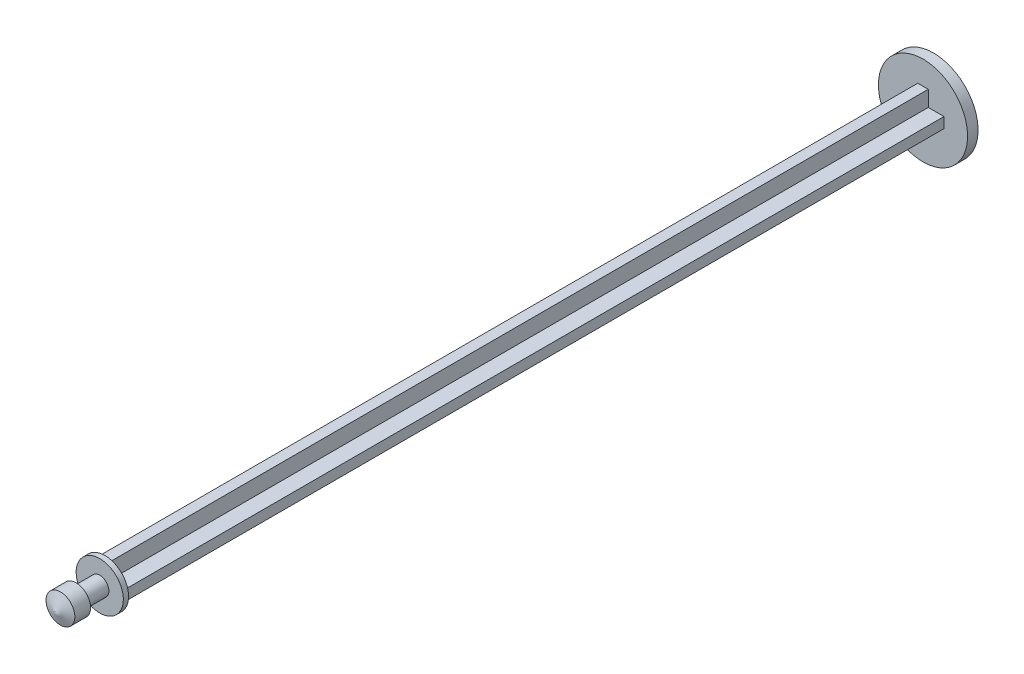
from build123d import *

# Parameters (mm, degrees)
AUFSATZ_LINEAR_AUSTRAGEN1_DEPTH = 78
SKIZZE3_R                       = 4.25
AUFSATZ_LINEAR_AUSTRAGEN3_DEPTH = 1
FASE1_SIZE2                     = 1.375
FASE1_SIZE                      = 0.500459072


with BuildPart() as part:
    # Skizze1 → Aufsatz-Linear austragen1 (new body)
    with BuildSketch(Plane.XY):
        Polygon((0.5, 0.5), (2, 0.5), (2, -0.5), (0.5, -0.5), (0.5, -2), (-0.5, -2), (-0.5, -0.5), (-2, -0.5), (-2, 0.5), (-0.5, 0.5), (-0.5, 2), (0.5, 2), align=None)
    extrude(amount=AUFSATZ_LINEAR_AUSTRAGEN1_DEPTH)

    # Skizze3 → Aufsatz-Linear austragen3 (add)
    with BuildSketch(Plane(origin=(0, 0, 0), x_dir=(-1, 0, 0), z_dir=(0, 0, -1))):
        Circle(SKIZZE3_R)
    extrude(amount=AUFSATZ_LINEAR_AUSTRAGEN3_DEPTH)

    # Skizze4 → Rotation1 (revolve)
    with BuildSketch(Plane(origin=(0, 0, 0), x_dir=(0, 0, -1), z_dir=(1, 0, 0))):
        Polygon((-78, 0), (-78, 1.335941473), (-78, 2.25), (-78.5, 2.25), (-78.5, 0.875), (-80.75, 0.875), (-80.75, 1.375), (-82.75, 1.375), (-82.75, 0), align=None)
    revolve(axis=Axis((0, 0, 0), (0, 0, 1)))

    # Fase1
    fase1_edges = [part.edges().sort_by_distance(p)[0] for p in [
        (0, -1.375, 82.75),
    ]]
    fase1_side = [part.faces().sort_by_distance(p)[0] for p in [
        (0, -1.375, 82.739990819),
    ]]
    chamfer(fase1_edges, length=FASE1_SIZE - 0.0001, length2=FASE1_SIZE2 - 0.0001, reference=fase1_side[0])  # a hair under: the kernel refuses the full size


solid = part.part
